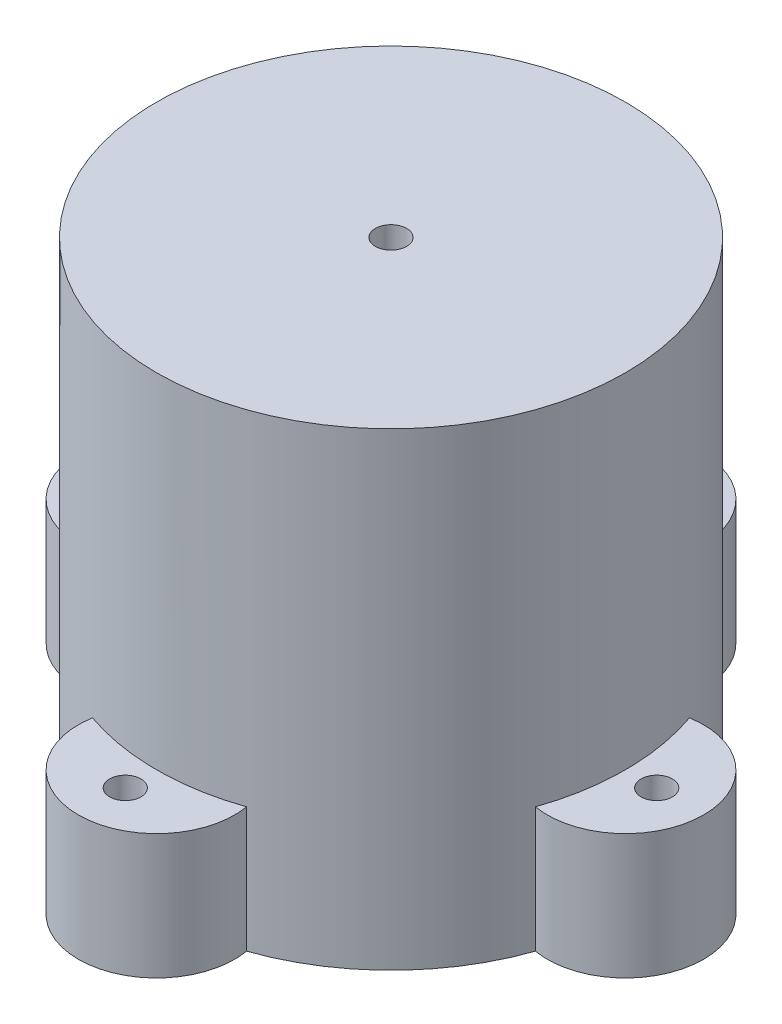
from build123d import *

# Parameters (mm, degrees)
SKETCH1_R           = 2.5
BOSS_EXTRUDE1_DEPTH = 75
SKETCH1_3_R         = 2.5
BOSS_EXTRUDE2_DEPTH = 20


with BuildPart() as part:
    # Sketch1 → Boss-Extrude1 (new body)
    with BuildSketch(Plane(origin=(0, 0, 0), x_dir=(1, 0, 0), z_dir=(0, 1, 0))):
        with BuildLine():
            ThreePointArc((-35.416666667, 12.325166215), (-37.5, 0), (-35.416666667, -12.325166215))
            ThreePointArc((-35.416666667, -12.325166215), (-26.516504294, -26.516504294), (-12.325166215, -35.416666667))
            ThreePointArc((-12.325166215, -35.416666667), (0, -37.5), (12.325166215, -35.416666667))
            ThreePointArc((12.325166215, -35.416666667), (26.516504294, -26.516504294), (35.416666667, -12.325166215))
            ThreePointArc((35.416666667, -12.325166215), (36.975498644, -6.25), (37.5, 0))
            ThreePointArc((37.5, 0), (36.975498644, 6.25), (35.416666667, 12.325166215))
            ThreePointArc((35.416666667, 12.325166215), (26.516504294, 26.516504294), (12.325166215, 35.416666667))
            ThreePointArc((12.325166215, 35.416666667), (0, 37.5), (-12.325166215, 35.416666667))
            ThreePointArc((-12.325166215, 35.416666667), (-26.516504294, 26.516504294), (-35.416666667, 12.325166215))
        make_face()
        Circle(SKETCH1_R, mode=Mode.SUBTRACT)
    extrude(amount=BOSS_EXTRUDE1_DEPTH)

    # Sketch1<3> → Boss-Extrude2 (add)
    # profile 1 of 4: a face of its own
    with BuildSketch(Plane(origin=(0, 0, 0), x_dir=(1, 0, 0), z_dir=(0, 1, 0))):
        with BuildLine():
            ThreePointArc((-35.416666667, 12.325166215), (-50, 0), (-35.416666667, -12.325166215))
            ThreePointArc((-35.416666667, -12.325166215), (-37.5, 0), (-35.416666667, 12.325166215))
        make_face()
        with Locations((-42.5, 0)):
            Circle(SKETCH1_3_R, mode=Mode.SUBTRACT)
    # profile 2 of 4: a face of its own
    with BuildSketch(Plane(origin=(0, 0, 0), x_dir=(1, 0, 0), z_dir=(0, 1, 0))):
        with BuildLine():
            ThreePointArc((12.325166215, -35.416666667), (0, -37.5), (-12.325166215, -35.416666667))
            ThreePointArc((-12.325166215, -35.416666667), (0, -50), (12.325166215, -35.416666667))
        make_face()
        with Locations((0, -42.5)):
            Circle(SKETCH1_3_R, mode=Mode.SUBTRACT)
    # profile 3 of 4: a face of its own
    with BuildSketch(Plane(origin=(0, 0, 0), x_dir=(1, 0, 0), z_dir=(0, 1, 0))):
        with BuildLine():
            ThreePointArc((12.325166215, 35.416666667), (0, 50), (-12.325166215, 35.416666667))
            ThreePointArc((-12.325166215, 35.416666667), (0, 37.5), (12.325166215, 35.416666667))
        make_face()
        with Locations((0, 42.5)):
            Circle(SKETCH1_3_R, mode=Mode.SUBTRACT)
    # profile 4 of 4: a face of its own
    with BuildSketch(Plane(origin=(0, 0, 0), x_dir=(1, 0, 0), z_dir=(0, 1, 0))):
        with BuildLine():
            ThreePointArc((35.416666667, 12.325166215), (37.5, 0), (35.416666667, -12.325166215))
            ThreePointArc((35.416666667, -12.325166215), (50, 0), (35.416666667, 12.325166215))
        make_face()
        with Locations((42.5, 0)):
            Circle(SKETCH1_3_R, mode=Mode.SUBTRACT)
    extrude(amount=BOSS_EXTRUDE2_DEPTH)


solid = part.part
